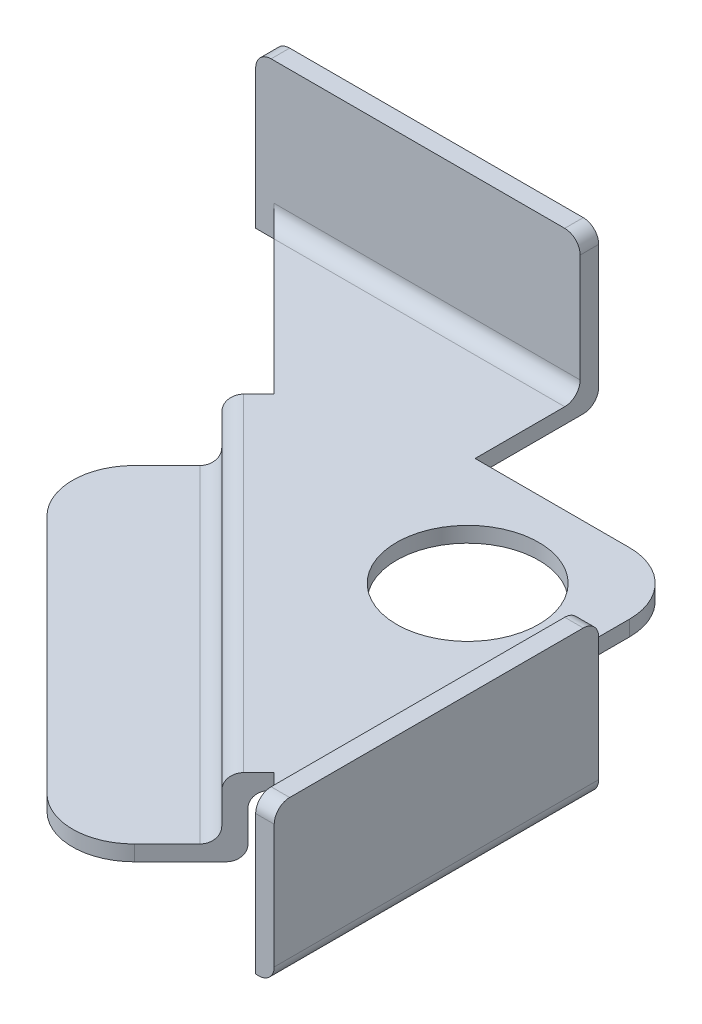
from build123d import *

# Parameters (mm, degrees)
SKETCH1_W                = 21.5
SKETCH1_H                = 21.5
BOSS_EXTRUDE1_DEPTH      = 0.5
SKETCH2_R                = 2.3
CUT_EXTRUDE1_DEPTH       = 31.409702399
FILLET1_R                = 2
BOSS_EXTRUDE2_DEPTH      = 4.5
BOSS_EXTRUDE2_DEPTH_BACK = 0.5
SKETCH3_W                = 0.6
SKETCH3_H                = 10.5
SKETCH3_W_2              = 10.5
SKETCH3_H_2              = 0.6
FILLET11_R               = 0.5
SKETCH6_W                = 15
SKETCH6_H                = 0.5
BOSS_EXTRUDE3_DEPTH      = 1.2
BOSS_EXTRUDE4_DEPTH      = 2
SKETCH9_W                = 15
SKETCH9_H                = 0.5
BOSS_EXTRUDE5_DEPTH      = 4
FILLET12_R               = 0.5
FILLET13_R               = 2


with BuildPart() as part:
    # Sketch1 → Boss-Extrude1 (new body)
    with BuildSketch(Plane(origin=(0, 0, 0), x_dir=(1, 0, 0), z_dir=(0, 1, 0))):
        with Locations((10.75, 10.75)):
            Rectangle(SKETCH1_W, SKETCH1_H)
    extrude(amount=BOSS_EXTRUDE1_DEPTH)

    # Sketch2 → Cut-Extrude1 (cut, through all)
    with BuildSketch(Plane(origin=(0, 0.5, 0), x_dir=(1, 0, 0), z_dir=(0, 1, 0))):
        Polygon((21.5, 0), (0, 21.5), (0, 0), align=None)
        Polygon((10.5, 21.5), (10.5, 17.5), (17.5, 17.5), (17.5, 10.5), (21.5, 10.5), (21.5, 21.5), align=None)
        with Locations((13.88, 13.88)):
            Circle(SKETCH2_R)
    extrude(amount=-CUT_EXTRUDE1_DEPTH, mode=Mode.SUBTRACT)

    # Fillet1
    fillet1_edges = [part.edges().sort_by_distance(p)[0] for p in [
        (17.5, 0.25, -17.5),
    ]]
    fillet(fillet1_edges, radius=FILLET1_R)

    # Sketch3 → Boss-Extrude2 (add, two sides: drawn at the far end of the back side and taken through both)
    with BuildSketch(Plane(origin=(0, 0.5, 0), x_dir=(1, 0, 0), z_dir=(0, 1, 0)).offset(-BOSS_EXTRUDE2_DEPTH_BACK)):
        with Locations((21.2, 5.25)):
            Rectangle(SKETCH3_W, SKETCH3_H)
        with Locations((5.25, 21.2)):
            Rectangle(SKETCH3_W_2, SKETCH3_H_2)
    extrude(amount=BOSS_EXTRUDE2_DEPTH + BOSS_EXTRUDE2_DEPTH_BACK)

    # Fillet11
    fillet11_edges = [part.edges().sort_by_distance(p)[0] for p in [
        (5.55, 0.5, -20.9),
        (0, 5, -21.2),
        (21.2, 5, 0),
        (21.2, 5, -10.5),
        (10.5, 5, -21.2),
        (5.25, 0, -21.5),
        (21.5, 0, -5.25),
        (20.9, 0.5, -5.55),
    ]]
    fillet(fillet11_edges, radius=FILLET11_R)

    # Sketch6 → Boss-Extrude3 (add)
    with BuildSketch(Plane(origin=(10.75, 0, -10.75), x_dir=(0.7071067811865475, 0, 0.7071067811865477), z_dir=(-0.7071067811865477, 0, 0.7071067811865475))):
        with Locations((0, 0.25)):
            Rectangle(SKETCH6_W, SKETCH6_H)
    extrude(amount=BOSS_EXTRUDE3_DEPTH)

    # Sketch8 → Boss-Extrude4 (add)
    with BuildSketch(Plane.XZ):
        Polygon((4.598171004, -15.204772721), (15.204772721, -4.598171004), (15.62903679, -5.022435072), (5.022435072, -15.62903679), align=None)
    extrude(amount=BOSS_EXTRUDE4_DEPTH)

    # Sketch9 → Boss-Extrude5 (add)
    with BuildSketch(Plane(origin=(9.901471863, 0, -9.901471863), x_dir=(0.7071067811865476, 0, 0.7071067811865476), z_dir=(-0.7071067811865476, 0, 0.7071067811865476))):
        with Locations((0, -1.75)):
            Rectangle(SKETCH9_W, SKETCH9_H)
    extrude(amount=BOSS_EXTRUDE5_DEPTH)

    # Fillet12
    fillet12_edges = [part.edges().sort_by_distance(p)[0] for p in [
        (10.325735931, 0, -10.325735931),
        (10.325735931, -2, -10.325735931),
        (9.901471863, 0.5, -9.901471863),
        (9.901471863, -1.5, -9.901471863),
    ]]
    fillet(fillet12_edges, radius=FILLET12_R)

    # Fillet13
    fillet13_edges = [part.edges().sort_by_distance(p)[0] for p in [
        (12.376345597, -1.75, -1.769743879),
        (1.769743879, -1.75, -12.376345597),
    ]]
    fillet(fillet13_edges, radius=FILLET13_R)


solid = part.part
